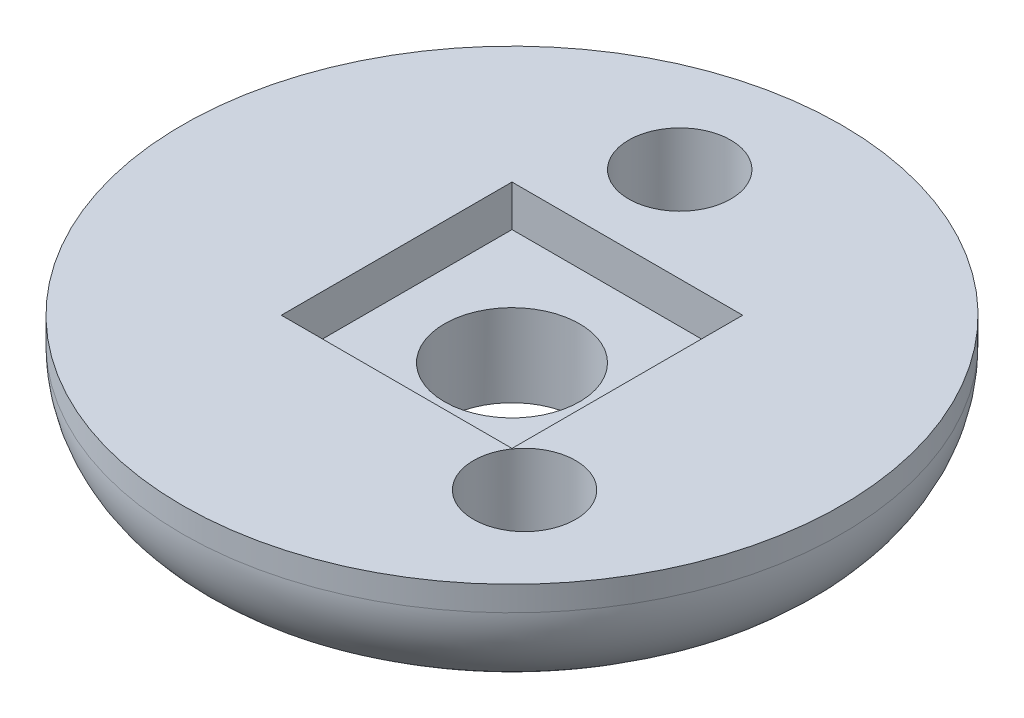
from build123d import *

# Parameters (mm, degrees)
BOSS_EXTRUDE1_DEPTH        = 3
BOSS_EXTRUDE1_DEPTH_BACK   = 10
SKETCH1_R                  = 10
SKETCH4_R                  = 1.5
HOLE_DEPTH                 = 20.973741561
HOLECIR_COUNT              = 5
SKETCH6_W                  = 7
SKETCH6_H                  = 7
BEARINGHOLE_DEPTH          = 2.5
SKETCH7_R                  = 2.05
SHAFTHOLE_DEPTH            = 17.248076982
F_3_1_3_1_DIAMETER_HOLE1_D = 3.1
FILLET2_R                  = 3
SKETCH11_R                 = 10
CUT_EXTRUDE1_DEPTH         = 10


with BuildPart() as part:
    # Sketch1 → Boss-Extrude1 (new, two sides: drawn at the far end of the back side and taken through both)
    with BuildSketch(Plane(origin=(0, 0, 0), x_dir=(1, 0, 0), z_dir=(0, 1, 0)).offset(-BOSS_EXTRUDE1_DEPTH_BACK)):
        with Locations(Location((0, 0, 0), (0, 0, 270))):
            Circle(SKETCH1_R)
    extrude(amount=BOSS_EXTRUDE1_DEPTH + BOSS_EXTRUDE1_DEPTH_BACK)

    # Sketch4 → hole (cut, through all)
    with BuildSketch(Plane(origin=(-3.352872105, -1.093066116, 1.887711608), x_dir=(-0.4486862613641547, -0.14627571033740308, -0.8816371449912632), z_dir=(0.8382180262940947, 0.2732665289126682, -0.47192790187872385))):
        with Locations(Location((0, 0, 0), (0, 0, 8.746528197))):
            Circle(SKETCH4_R)
    hole = extrude(amount=-HOLE_DEPTH, mode=Mode.SUBTRACT)

    # holecir: hole ×5 about axis
    holecir_axis = Axis((0, 0, 0), (0, 1, 0))
    for i in range(1, HOLECIR_COUNT):
        add(hole.rotate(holecir_axis, i * 360 / HOLECIR_COUNT), mode=Mode.SUBTRACT)

    # Sketch6 → bearinghole (cut)
    with BuildSketch(Plane(origin=(0, -5, 0), x_dir=(-1, 0, 0), z_dir=(0, -1, 0))):
        Rectangle(SKETCH6_W, SKETCH6_H)
    extrude(amount=BEARINGHOLE_DEPTH, mode=Mode.SUBTRACT)

    # Sketch7 → shafthole (cut, through all)
    with BuildSketch(Plane(origin=(0, -5, 0), x_dir=(-1, 0, 0), z_dir=(0, -1, 0))):
        with Locations(Location((0, 0, 0), (0, 0, 270))):
            Circle(SKETCH7_R)
    extrude(amount=SHAFTHOLE_DEPTH, mode=Mode.SUBTRACT)

    # Ø3.1 (3.1) Diameter Hole1 (through all)
    with Locations(Plane(origin=(0, 3, 0), x_dir=(1, 0, 0), z_dir=(0, 1, 0))):
        with Locations((-1.282558474, 6.372208703), (4.783101903, -4.401356176)):
            Hole(F_3_1_3_1_DIAMETER_HOLE1_D / 2)

    # Fillet2
    # the kernel refuses this fillet: 3 mm, written as the material it takes off along each edge
    with BuildSketch(Plane(origin=(0, 3, 0), x_dir=(0, 0, 1), z_dir=(-1, 0, 0))) as fillet2_piece_1:
        with BuildLine():
            CenterArc((10 - FILLET2_R, -FILLET2_R), FILLET2_R, 0, 90)
            Line((10 - FILLET2_R, 0), (10, 0))
            Line((10, 0), (10, -FILLET2_R))
        make_face()
    revolve(axis=Axis((0, 3, 0), (0, 1, 0)), mode=Mode.SUBTRACT)
    with BuildSketch(Plane(origin=(0, -10, 0), x_dir=(0, 0, 1), z_dir=(-1, 0, 0))) as fillet2_piece_2:
        with BuildLine():
            CenterArc((10 - FILLET2_R, FILLET2_R), FILLET2_R, 270, 90)
            Line((10 - FILLET2_R, 0), (10, 0))
            Line((10, 0), (10, FILLET2_R))
        make_face()
    revolve(axis=Axis((0, -10, 0), (0, 1, 0)), mode=Mode.SUBTRACT)

    # Sketch11 → Cut-Extrude1 (cut)
    with BuildSketch(Plane(origin=(0, -6.25, 0), x_dir=(-1, 0, 0), z_dir=(0, -1, 0))):
        with Locations(Location((0, 0, 0), (0, 0, 270))):
            Circle(SKETCH11_R)
    extrude(amount=-CUT_EXTRUDE1_DEPTH, mode=Mode.SUBTRACT)


solid = part.part
